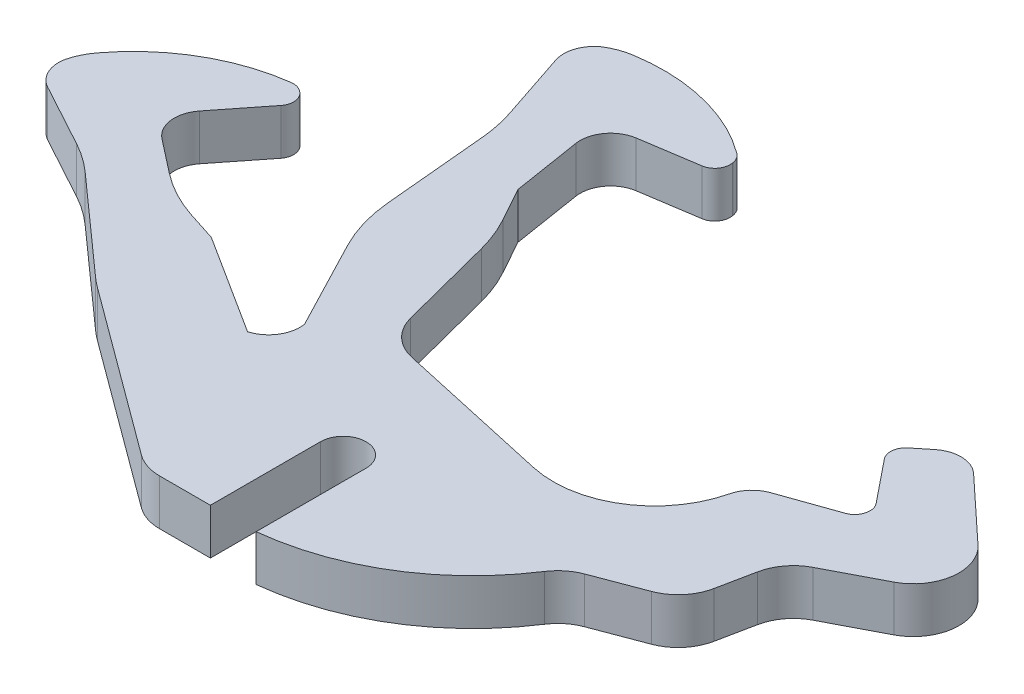
from build123d import *

# Parameters (mm, degrees)
BOSS_EXTRUDE1_DEPTH = 3
FILLET1_R           = 10
FILLET2_R           = 2
FILLET3_R           = 4
FILLET4_R           = 1
FILLET5_R           = 2
FILLET6_R           = 3
FILLET7_R           = 2
FILLET8_R           = 1


with BuildPart() as part:
    # Sketch1 → Boss-Extrude1 (new body)
    with BuildSketch(Plane(origin=(0, 0, 0), x_dir=(1, 0, 0), z_dir=(0, 1, 0))):
        with BuildLine():
            Line((0, 0), (0, 7.21))
            ThreePointArc((0, 7.21), (1.5, 8.71), (3, 7.21))
            Line((3, 7.21), (3, 0))
            ThreePointArc((3, 0), (10.063508451, 2.530649612), (15.2, 8))
            Line((15.2, 8), (20.9, 10.15))
            Line((20.9, 10.15), (22, 15.56))
            Line((22, 15.56), (30.53, 20))
            Line((30.53, 20), (21.94, 28))
            Line((21.94, 28), (18.834507406, 25.494802254))
            Line((18.834507406, 25.494802254), (22.601722061, 20.824888578))
            Line((22.601722061, 20.824888578), (16.53, 18.68))
            ThreePointArc((16.53, 18.68), (13.852574152, 13.870404311), (8.467766761, 12.728183128))
            Line((8.467766761, 12.728183128), (-3.6, 15.4))
            Line((-3.6, 15.4), (-6, 24.68))
            Line((-6, 24.68), (-7.84518958, 28))
            Line((-7.84518958, 28), (-8.88, 34.5))
            Line((-8.88, 34.5), (-2.152236064, 35.529882091))
            Line((-2.152236064, 35.529882091), (-2.387170471, 36.974018228))
            ThreePointArc((-2.387170471, 36.974018228), (-7.295622624, 39.289989721), (-12.7222653, 39.199569746))
            Line((-12.7222653, 39.199569746), (-14.412236064, 37.968616292))
            Line((-14.412236064, 37.968616292), (-12.083283256, 30.98175787))
            Line((-12.083283256, 30.98175787), (-11.160586433, 20.989038892))
            Line((-11.160586433, 20.989038892), (-7.18770511, 13.356453829))
            ThreePointArc((-7.18770511, 13.356453829), (-7.478060289, 11.939326713), (-8.633960614, 11.06958547))
            Line((-8.633960614, 11.06958547), (-15.174962181, 15.236636279))
            Line((-15.174962181, 15.236636279), (-18.788682966, 16.406314301))
            Line((-18.788682966, 16.406314301), (-23.978484738, 20.454374352))
            Line((-23.978484738, 20.454374352), (-19.760487577, 25.795906403))
            Line((-19.760487577, 25.795906403), (-20.917206202, 26.691855832))
            ThreePointArc((-20.917206202, 26.691855832), (-26.082048226, 24.977316424), (-29.953541863, 21.152819654))
            Line((-29.953541863, 21.152819654), (-30.35, 19.1))
            Line((-30.35, 19.1), (-23.881685757, 15.578477225))
            Line((-23.881685757, 15.578477225), (-16.391850065, 8.899542932))
            Line((-16.391850065, 8.899542932), (-4.31, 0))
            Line((-4.31, 0), (0, 0))
        make_face()
    extrude(amount=BOSS_EXTRUDE1_DEPTH)

    # Fillet1
    # the kernel refuses this fillet: 10 mm, written as the material it adds along each edge
    with BuildSketch(Plane(origin=(-23.881685757, 0, -15.578477225), x_dir=(0.7463543086555258, 0, 0.6655488306287767), z_dir=(0, 1, 0))) as fillet1_piece_1:
        with BuildLine():
            CenterArc((FILLET1_R * 0.115344853594, -FILLET1_R), FILLET1_R, 90, 13.159392789)
            Line((-FILLET1_R * 0.112315955105, -FILLET1_R * 0.0262595026484), (0, 0))
            Line((0, 0), (FILLET1_R * 0.115344853594, 0))
        make_face()
    extrude(amount=3)
    with BuildSketch(Plane(origin=(-18.788682966, 0, -16.406314301), x_dir=(0.9514034075145552, 0, 0.3079473269403278), z_dir=(0, 1, 0))) as fillet1_piece_2:
        with BuildLine():
            CenterArc((FILLET1_R * 0.176495798458, FILLET1_R), FILLET1_R, 249.981238779, 20.018761221)
            Line((-FILLET1_R * 0.165832024258, FILLET1_R * 0.0604194224044), (0, 0))
            Line((0, 0), (FILLET1_R * 0.176495798458, 0))
        make_face()
    extrude(amount=3)
    with BuildSketch(Plane(origin=(-12.083283256, 0, -30.98175787), x_dir=(-0.3162277660168379, 0, -0.9486832980505138), z_dir=(0, 1, 0))) as fillet1_piece_3:
        with BuildLine():
            CenterArc((FILLET1_R * 0.115344853594, FILLET1_R), FILLET1_R, 256.840607211, 13.159392789)
            Line((-FILLET1_R * 0.112315955105, FILLET1_R * 0.0262595026484), (0, 0))
            Line((0, 0), (FILLET1_R * 0.115344853594, 0))
        make_face()
    extrude(amount=3)
    # the kernel refuses this fillet: 10 mm, written as the material it takes off along each edge
    with BuildSketch(Plane(origin=(-16.391850065, -1.167802292, -8.899542932), x_dir=(-0.7463543086555279, 0, -0.6655488306287745), z_dir=(0, 1, 0))) as fillet1_2_piece_1:
        with BuildLine():
            CenterArc((FILLET1_R * 0.0467120916838, -FILLET1_R), FILLET1_R, 90, 5.348923188)
            Line((-FILLET1_R * 0.0465086821366, -FILLET1_R * 0.00435453733353), (0, 0))
            Line((0, 0), (FILLET1_R * 0.0467120916838, 0))
        make_face()
    extrude(amount=5.335604584, mode=Mode.SUBTRACT)
    with BuildSketch(Plane(origin=(-11.160586433, -4.90982012, -20.989038892), x_dir=(-0.09194577532432974, 0, -0.9957640154173116), z_dir=(0, 1, 0))) as fillet1_2_piece_2:
        with BuildLine():
            CenterArc((FILLET1_R * 0.196392804796, -FILLET1_R), FILLET1_R, 90, 22.222134755)
            Line((-FILLET1_R * 0.18180564018, -FILLET1_R * 0.0742754533783), (0, 0))
            Line((0, 0), (FILLET1_R * 0.196392804796, 0))
        make_face()
    extrude(amount=12.81964024, mode=Mode.SUBTRACT)
    with BuildSketch(Plane(origin=(-6, -3.194649605, -24.68), x_dir=(0.2503828219685178, 0, 0.9681469116116013), z_dir=(0, 1, 0))) as fillet1_2_piece_3:
        with BuildLine():
            CenterArc((FILLET1_R * 0.127785984198, -FILLET1_R), FILLET1_R, 90, 14.564262893)
            Line((-FILLET1_R * 0.123679735642, -FILLET1_R * 0.0321337945019), (0, 0))
            Line((0, 0), (FILLET1_R * 0.127785984198, 0))
        make_face()
    extrude(amount=9.38929921, mode=Mode.SUBTRACT)

    # Fillet2
    fillet2_edges = [part.edges().sort_by_distance(p)[0] for p in [
        (-30.35, 1.5, -19.1),
        (-14.412236064, 1.5, -37.968616292),
    ]]
    fillet(fillet2_edges, radius=FILLET2_R)

    # Fillet3
    # the kernel refuses this fillet: 4 mm, written as the material it takes off along each edge
    with BuildSketch(Plane(origin=(-12.7222653, -2.572689519, -39.199569746), x_dir=(-0.8083072770831305, 0, 0.5887608562179175), z_dir=(0, 1, 0))) as fillet3_piece_1:
        with BuildLine():
            CenterArc((0.875361271, 3.992337402), FILLET3_R, 243.063834504, 23.389134387)
            ThreePointArc((-0.936628841, 0.426290314), (-0.472898898, 0.203072318), (0, 0))
            Line((0, 0), (0.627889929, 0))
        make_face()
    extrude(amount=8.145379038, mode=Mode.SUBTRACT)
    with BuildSketch(Plane(origin=(-29.953541863, -2.496436383, -21.152819654), x_dir=(-0.18962458073088623, 0, 0.9818566689607173), z_dir=(0, 1, 0))) as fillet3_piece_2:
        with BuildLine():
            CenterArc((0.842574318, 3.994234672), FILLET3_R, 243.941405888, 22.981988472)
            ThreePointArc((-0.914585995, 0.400853585), (-0.461476033, 0.190882795), (0, 0))
            Line((0, 0), (0.627889929, 0))
        make_face()
    extrude(amount=7.992872766, mode=Mode.SUBTRACT)

    # Fillet4
    fillet4_edges = [part.edges().sort_by_distance(p)[0] for p in [
        (-20.917206202, 1.5, -26.691855832),
        (-19.760487577, 1.5, -25.795906403),
        (-2.387170471, 1.5, -36.974018228),
        (-2.152236064, 1.5, -35.529882091),
    ]]
    fillet(fillet4_edges, radius=FILLET4_R)

    # Fillet5
    fillet5_edges = [part.edges().sort_by_distance(p)[0] for p in [
        (-23.978484738, 1.5, -20.454374352),
        (-8.88, 1.5, -34.5),
    ]]
    fillet(fillet5_edges, radius=FILLET5_R)

    # Fillet6
    fillet6_edges = [part.edges().sort_by_distance(p)[0] for p in [
        (-4.31, 1.5, 0),
        (-3.6, 1.5, -15.4),
        (30.53, 1.5, -20),
        (22, 1.5, -15.56),
        (20.9, 1.5, -10.15),
        (15.2, 1.5, -8),
    ]]
    fillet(fillet6_edges, radius=FILLET6_R)

    # Fillet7
    fillet7_edges = [part.edges().sort_by_distance(p)[0] for p in [
        (16.53, 1.5, -18.68),
        (21.94, 1.5, -28),
    ]]
    fillet(fillet7_edges, radius=FILLET7_R)

    # Fillet8
    fillet8_edges = [part.edges().sort_by_distance(p)[0] for p in [
        (22.601722061, 1.5, -20.824888578),
        (18.834507406, 1.5, -25.494802254),
    ]]
    fillet(fillet8_edges, radius=FILLET8_R)


solid = part.part
